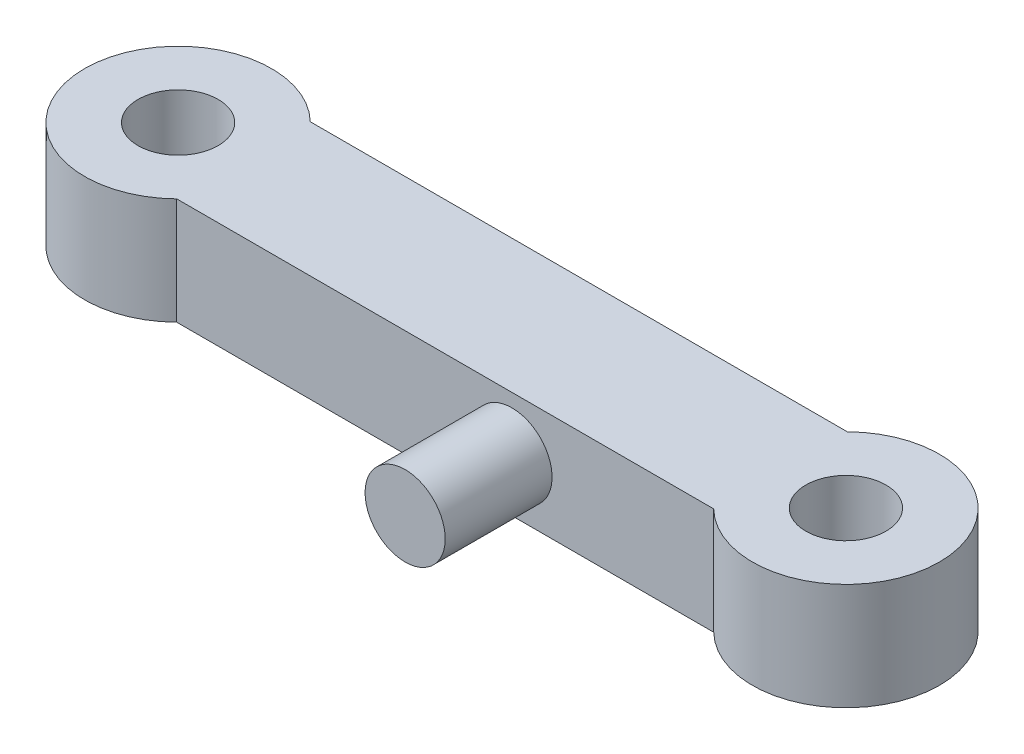
from build123d import *

# Parameters (mm, degrees)
SKETCH_1_R      = 1.5
EXTRUDE_1_DEPTH = 4
SKETCH_2_R      = 1.5
EXTRUDE_2_DEPTH = 4


with BuildPart() as part:
    # Эскиз1 → Бобышка-Вытянуть1 (new body)
    with BuildSketch(Plane(origin=(0, 0, 0), x_dir=(1, 0, 0), z_dir=(0, 1, 0))):
        with BuildLine():
            Line((-10.050510257, -2.5), (10.050510257, -2.5))
            ThreePointArc((10.050510257, -2.5), (16, 0), (10.050510257, 2.5))
            Line((10.050510257, 2.5), (-10.050510257, 2.5))
            ThreePointArc((-10.050510257, 2.5), (-16, 0), (-10.050510257, -2.5))
        make_face()
        with Locations((-12.5, 0)):
            Circle(SKETCH_1_R, mode=Mode.SUBTRACT)
        with Locations((12.5, 0)):
            Circle(SKETCH_1_R, mode=Mode.SUBTRACT)
    extrude(amount=EXTRUDE_1_DEPTH)

    # Эскиз2 → Бобышка-Вытянуть2 (add)
    with BuildSketch(Plane.XY.offset(2.5)):
        with Locations((2.5, 2)):
            Circle(SKETCH_2_R)
    extrude(amount=EXTRUDE_2_DEPTH)


solid = part.part
